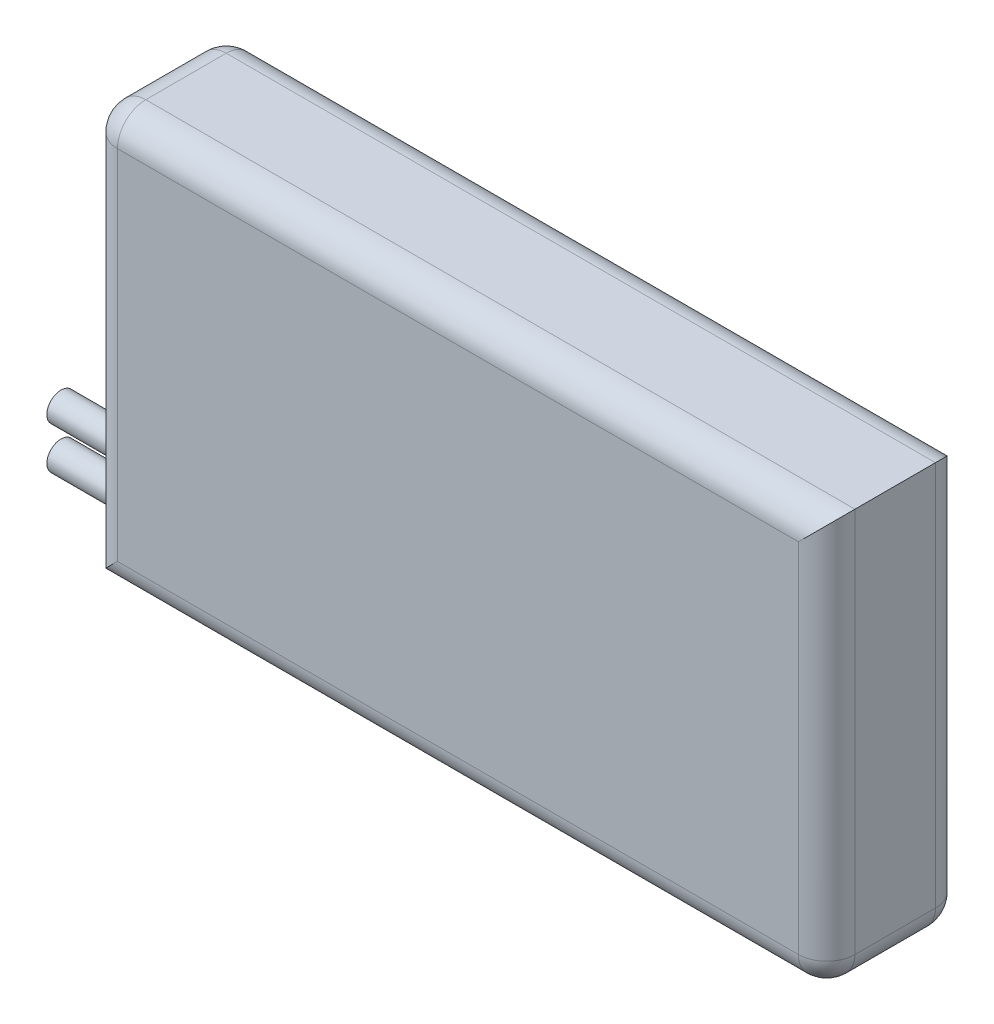
from build123d import *

# Parameters (mm, degrees)
SKETCH1_W           = 52.2
SKETCH1_H           = 29.3
BOSS_EXTRUDE1_DEPTH = 9.7
SKETCH2_R           = 1
BOSS_EXTRUDE2_DEPTH = 7
FILLET1_R           = 2
FILLET2_R           = 2
FILLET3_R           = 2
FILLET4_R           = 2


with BuildPart() as part:
    # Sketch1 → Boss-Extrude1 (new body)
    with BuildSketch(Plane.XY):
        Rectangle(SKETCH1_W, SKETCH1_H)
    extrude(amount=BOSS_EXTRUDE1_DEPTH)

    # Sketch2 → Boss-Extrude2 (add)
    with BuildSketch(Plane.ZY.offset(26.1)):
        with Locations(Location((4.7, -13.15, 0), (0, 0, 180))):
            Circle(SKETCH2_R)
        with Locations(Location((4.7, -10.15, 0), (0, 0, 180))):
            Circle(SKETCH2_R)
    extrude(amount=BOSS_EXTRUDE2_DEPTH)

    # Fillet1
    fillet1_edges = [part.edges().sort_by_distance(p)[0] for p in [
        (26.1, 0, 9.7),
        (0, 14.65, 9.7),
        (-26.1, 0, 9.7),
        (0, -14.65, 9.7),
    ]]
    fillet(fillet1_edges, radius=FILLET1_R)

    # Fillet2
    fillet2_edges = [part.edges().sort_by_distance(p)[0] for p in [
        (0, 14.65, 0),
        (26.1, 0, 0),
        (0, -14.65, 0),
        (-26.1, 0, 0),
    ]]
    fillet(fillet2_edges, radius=FILLET2_R)

    # Fillet3
    # the kernel refuses this fillet: 2 mm, written as the material it takes off along each edge
    with BuildSketch(Plane(origin=(-24.1, 12.65, 7.7), x_dir=(0, 1, 0), z_dir=(-1, 0, 0))) as fillet3_piece_1_section:
        Polygon((0, 0), (FILLET3_R, 0), (FILLET3_R, -FILLET3_R), (0, -FILLET3_R), align=None)
    fillet3_piece_1 = extrude(amount=FILLET3_R, mode=Mode.PRIVATE)
    fillet3_piece_1 = fillet3_piece_1 - Plane(origin=(-24.1, 12.65, 7.7), x_dir=(0, -0.7071067811865475, -0.7071067811865475), z_dir=(-1, 0, 0)) * Sphere(FILLET3_R, mode=Mode.PRIVATE)
    add(fillet3_piece_1, mode=Mode.SUBTRACT)
    with BuildSketch(Plane(origin=(-24.1, 12.65, 2), x_dir=(0, 1, 0), z_dir=(-1, 0, 0))) as fillet3_piece_2_section:
        Polygon((0, 0), (FILLET3_R, 0), (FILLET3_R, FILLET3_R), (0, FILLET3_R), align=None)
    fillet3_piece_2 = extrude(amount=FILLET3_R, mode=Mode.PRIVATE)
    fillet3_piece_2 = fillet3_piece_2 - Plane(origin=(-24.1, 12.65, 2), x_dir=(0, -0.7071067811865475, 0.7071067811865475), z_dir=(-1, 0, 0)) * Sphere(FILLET3_R, mode=Mode.PRIVATE)
    add(fillet3_piece_2, mode=Mode.SUBTRACT)
    with BuildSketch(Plane(origin=(-26.1, 14.65, 2), x_dir=(0, -1, 0), z_dir=(0, 0, 1))) as fillet3_piece_3:
        with BuildLine():
            CenterArc((FILLET3_R, FILLET3_R), FILLET3_R, 180, 90)
            Line((0, FILLET3_R), (0, 0))
            Line((0, 0), (FILLET3_R, 0))
        make_face()
    extrude(amount=5.7, mode=Mode.SUBTRACT)

    # Fillet4
    # the kernel refuses this fillet: 2 mm, written as the material it takes off along each edge
    with BuildSketch(Plane(origin=(24.1, -12.65, 7.7), x_dir=(1, 0, 0), z_dir=(0, -1, 0))) as fillet4_piece_1_section:
        Polygon((0, 0), (FILLET4_R, 0), (FILLET4_R, FILLET4_R), (0, FILLET4_R), align=None)
    fillet4_piece_1 = extrude(amount=FILLET4_R, mode=Mode.PRIVATE)
    fillet4_piece_1 = fillet4_piece_1 - Plane(origin=(24.1, -12.65, 7.7), x_dir=(-0.7071067811865475, 0, -0.7071067811865475), z_dir=(0, -1, 0)) * Sphere(FILLET4_R, mode=Mode.PRIVATE)
    add(fillet4_piece_1, mode=Mode.SUBTRACT)
    with BuildSketch(Plane(origin=(24.1, -12.65, 2), x_dir=(1, 0, 0), z_dir=(0, -1, 0))) as fillet4_piece_2_section:
        Polygon((0, 0), (FILLET4_R, 0), (FILLET4_R, -FILLET4_R), (0, -FILLET4_R), align=None)
    fillet4_piece_2 = extrude(amount=FILLET4_R, mode=Mode.PRIVATE)
    fillet4_piece_2 = fillet4_piece_2 - Plane(origin=(24.1, -12.65, 2), x_dir=(-0.7071067811865475, 0, 0.7071067811865475), z_dir=(0, -1, 0)) * Sphere(FILLET4_R, mode=Mode.PRIVATE)
    add(fillet4_piece_2, mode=Mode.SUBTRACT)
    with BuildSketch(Plane(origin=(26.1, -14.65, 2), x_dir=(-1, 0, 0), z_dir=(0, 0, 1))) as fillet4_piece_3:
        with BuildLine():
            CenterArc((FILLET4_R, -FILLET4_R), FILLET4_R, 90, 90)
            Line((0, -FILLET4_R), (0, 0))
            Line((0, 0), (FILLET4_R, 0))
        make_face()
    extrude(amount=5.7, mode=Mode.SUBTRACT)


solid = part.part
